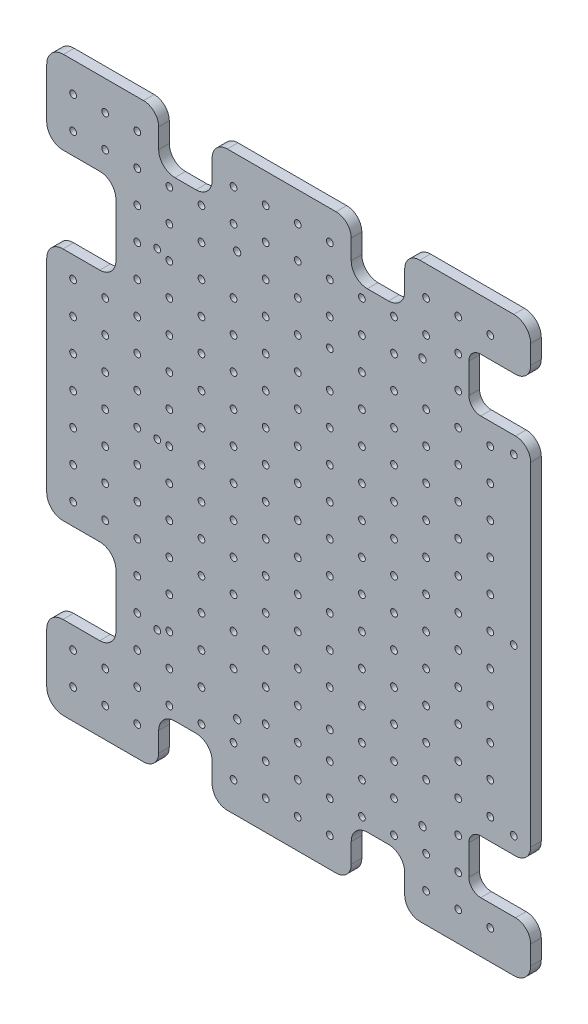
from build123d import *

# Parameters (mm, degrees)
SKETCH1_W                            = 287.27
SKETCH1_H                            = 340
BASE_PLATE_EXTRUDE_DEPTH             = 6.3
SKETCH3_R                            = 2
SKETCH3_R_2                          = 2.15
PLATE_TO_PLATE_MNT_THRU_HOLE_DEPTH   = 223.644791596
SKETCH4_R                            = 2
CENTER_PERFORATION_THRU_HOLE_DEPTH   = 223.644791596
SKETCH6_R                            = 2
EXTENDED_PERFORATION_THRU_HOLE_DEPTH = 223.644791596
CABLE_ROUTING_CUTOUT_DEPTH           = 223.644791596
FILLET1_R                            = 10


with BuildPart() as part:
    # Sketch1 → Base_Plate-Extrude (new body)
    with BuildSketch(Plane.XY):
        Rectangle(SKETCH1_W, SKETCH1_H)
    extrude(amount=BASE_PLATE_EXTRUDE_DEPTH)

    # Sketch3 → Plate_to_Plate_Mnt-Thru-Hole (cut, through all)
    with BuildSketch(Plane.XY.offset(6.3)):
        with Locations((133.635, 98)):
            Circle(SKETCH3_R)
        with Locations((24.415, 98)):
            Circle(SKETCH3_R)
        with Locations((-78.025, 98)):
            Circle(SKETCH3_R)
        with Locations((-78.025, -98)):
            Circle(SKETCH3_R)
        with Locations((24.415, -98)):
            Circle(SKETCH3_R)
        with Locations((133.635, -98)):
            Circle(SKETCH3_R)
        with Locations((133.635, 0)):
            Circle(SKETCH3_R)
        with Locations((-78.025, 0)):
            Circle(SKETCH3_R)
        with Locations((79.415, -120.25)):
            Circle(SKETCH3_R_2)
        with Locations((-30.585, -120.25)):
            Circle(SKETCH3_R_2)
        with Locations((-30.585, 120.25)):
            Circle(SKETCH3_R_2)
        with Locations((79.415, 120.25)):
            Circle(SKETCH3_R_2)
    extrude(amount=-PLATE_TO_PLATE_MNT_THRU_HOLE_DEPTH, mode=Mode.SUBTRACT)

    # Sketch4 → Center_Perforation-Thru-Hole (cut, through all)
    with BuildSketch(Plane.XY.offset(6.3)):
        with Locations((-70.835, 0)):
            Circle(SKETCH4_R)
        with Locations((-51.785, 0)):
            Circle(SKETCH4_R)
        with Locations((-32.735, 0)):
            Circle(SKETCH4_R)
        with Locations((-13.685, 0)):
            Circle(SKETCH4_R)
        with Locations((5.365, 0)):
            Circle(SKETCH4_R)
        with Locations((24.415, 0)):
            Circle(SKETCH4_R)
        with Locations((43.465, 0)):
            Circle(SKETCH4_R)
        with Locations((62.515, 0)):
            Circle(SKETCH4_R)
        with Locations((81.565, 0)):
            Circle(SKETCH4_R)
        with Locations((100.615, 0)):
            Circle(SKETCH4_R)
        with Locations((119.665, 0)):
            Circle(SKETCH4_R)
        with Locations((-70.835, 19.05)):
            Circle(SKETCH4_R)
        with Locations((-51.785, 19.05)):
            Circle(SKETCH4_R)
        with Locations((-32.735, 19.05)):
            Circle(SKETCH4_R)
        with Locations((-13.685, 19.05)):
            Circle(SKETCH4_R)
        with Locations((5.365, 19.05)):
            Circle(SKETCH4_R)
        with Locations((24.415, 19.05)):
            Circle(SKETCH4_R)
        with Locations((43.465, 19.05)):
            Circle(SKETCH4_R)
        with Locations((62.515, 19.05)):
            Circle(SKETCH4_R)
        with Locations((81.565, 19.05)):
            Circle(SKETCH4_R)
        with Locations((100.615, 19.05)):
            Circle(SKETCH4_R)
        with Locations((119.665, 19.05)):
            Circle(SKETCH4_R)
        with Locations((-70.835, 38.1)):
            Circle(SKETCH4_R)
        with Locations((-51.785, 38.1)):
            Circle(SKETCH4_R)
        with Locations((-32.735, 38.1)):
            Circle(SKETCH4_R)
        with Locations((-13.685, 38.1)):
            Circle(SKETCH4_R)
        with Locations((5.365, 38.1)):
            Circle(SKETCH4_R)
        with Locations((24.415, 38.1)):
            Circle(SKETCH4_R)
        with Locations((43.465, 38.1)):
            Circle(SKETCH4_R)
        with Locations((62.515, 38.1)):
            Circle(SKETCH4_R)
        with Locations((81.565, 38.1)):
            Circle(SKETCH4_R)
        with Locations((100.615, 38.1)):
            Circle(SKETCH4_R)
        with Locations((119.665, 38.1)):
            Circle(SKETCH4_R)
        with Locations((-70.835, 57.15)):
            Circle(SKETCH4_R)
        with Locations((-51.785, 57.15)):
            Circle(SKETCH4_R)
        with Locations((-32.735, 57.15)):
            Circle(SKETCH4_R)
        with Locations((-13.685, 57.15)):
            Circle(SKETCH4_R)
        with Locations((5.365, 57.15)):
            Circle(SKETCH4_R)
        with Locations((24.415, 57.15)):
            Circle(SKETCH4_R)
        with Locations((43.465, 57.15)):
            Circle(SKETCH4_R)
        with Locations((62.515, 57.15)):
            Circle(SKETCH4_R)
        with Locations((81.565, 57.15)):
            Circle(SKETCH4_R)
        with Locations((100.615, 57.15)):
            Circle(SKETCH4_R)
        with Locations((119.665, 57.15)):
            Circle(SKETCH4_R)
        with Locations((-70.835, -19.05)):
            Circle(SKETCH4_R)
        with Locations((-51.785, -19.05)):
            Circle(SKETCH4_R)
        with Locations((-32.735, -19.05)):
            Circle(SKETCH4_R)
        with Locations((-13.685, -19.05)):
            Circle(SKETCH4_R)
        with Locations((5.365, -19.05)):
            Circle(SKETCH4_R)
        with Locations((24.415, -19.05)):
            Circle(SKETCH4_R)
        with Locations((43.465, -19.05)):
            Circle(SKETCH4_R)
        with Locations((62.515, -19.05)):
            Circle(SKETCH4_R)
        with Locations((81.565, -19.05)):
            Circle(SKETCH4_R)
        with Locations((100.615, -19.05)):
            Circle(SKETCH4_R)
        with Locations((119.665, -19.05)):
            Circle(SKETCH4_R)
        with Locations((-70.835, -38.1)):
            Circle(SKETCH4_R)
        with Locations((-51.785, -38.1)):
            Circle(SKETCH4_R)
        with Locations((-32.735, -38.1)):
            Circle(SKETCH4_R)
        with Locations((-13.685, -38.1)):
            Circle(SKETCH4_R)
        with Locations((5.365, -38.1)):
            Circle(SKETCH4_R)
        with Locations((24.415, -38.1)):
            Circle(SKETCH4_R)
        with Locations((43.465, -38.1)):
            Circle(SKETCH4_R)
        with Locations((62.515, -38.1)):
            Circle(SKETCH4_R)
        with Locations((81.565, -38.1)):
            Circle(SKETCH4_R)
        with Locations((100.615, -38.1)):
            Circle(SKETCH4_R)
        with Locations((119.665, -38.1)):
            Circle(SKETCH4_R)
        with Locations((-70.835, -57.15)):
            Circle(SKETCH4_R)
        with Locations((-51.785, -57.15)):
            Circle(SKETCH4_R)
        with Locations((-32.735, -57.15)):
            Circle(SKETCH4_R)
        with Locations((-13.685, -57.15)):
            Circle(SKETCH4_R)
        with Locations((5.365, -57.15)):
            Circle(SKETCH4_R)
        with Locations((24.415, -57.15)):
            Circle(SKETCH4_R)
        with Locations((43.465, -57.15)):
            Circle(SKETCH4_R)
        with Locations((62.515, -57.15)):
            Circle(SKETCH4_R)
        with Locations((81.565, -57.15)):
            Circle(SKETCH4_R)
        with Locations((100.615, -57.15)):
            Circle(SKETCH4_R)
        with Locations((119.665, -57.15)):
            Circle(SKETCH4_R)
    extrude(amount=-CENTER_PERFORATION_THRU_HOLE_DEPTH, mode=Mode.SUBTRACT)

    # Sketch6 → Extended_Perforation-Thru-Hole (cut, through all)
    with BuildSketch(Plane.XY.offset(6.3)):
        with Locations((-89.885, 0)):
            Circle(SKETCH6_R)
        with Locations((-51.785, -95.25)):
            Circle(SKETCH6_R)
        with Locations((-70.835, -95.25)):
            Circle(SKETCH6_R)
        with Locations((-108.935, 0)):
            Circle(SKETCH6_R)
        with Locations((-127.985, 0)):
            Circle(SKETCH6_R)
        with Locations((-89.885, 19.05)):
            Circle(SKETCH6_R)
        with Locations((-108.935, 19.05)):
            Circle(SKETCH6_R)
        with Locations((-127.985, 19.05)):
            Circle(SKETCH6_R)
        with Locations((-89.885, 38.1)):
            Circle(SKETCH6_R)
        with Locations((-108.935, 38.1)):
            Circle(SKETCH6_R)
        with Locations((-127.985, 38.1)):
            Circle(SKETCH6_R)
        with Locations((-89.885, 57.15)):
            Circle(SKETCH6_R)
        with Locations((-108.935, 57.15)):
            Circle(SKETCH6_R)
        with Locations((-127.985, 57.15)):
            Circle(SKETCH6_R)
        with Locations((-89.885, 76.2)):
            Circle(SKETCH6_R)
        with Locations((-108.935, 76.2)):
            Circle(SKETCH6_R)
        with Locations((-127.985, 76.2)):
            Circle(SKETCH6_R)
        with Locations((-89.885, 95.25)):
            Circle(SKETCH6_R)
        with Locations((-108.935, 95.25)):
            Circle(SKETCH6_R)
        with Locations((-127.985, 95.25)):
            Circle(SKETCH6_R)
        with Locations((-89.885, 114.3)):
            Circle(SKETCH6_R)
        with Locations((-108.935, 114.3)):
            Circle(SKETCH6_R)
        with Locations((-127.985, 114.3)):
            Circle(SKETCH6_R)
        with Locations((-89.885, 133.35)):
            Circle(SKETCH6_R)
        with Locations((-108.935, 133.35)):
            Circle(SKETCH6_R)
        with Locations((-127.985, 133.35)):
            Circle(SKETCH6_R)
        with Locations((-89.885, 152.4)):
            Circle(SKETCH6_R)
        with Locations((-108.935, 152.4)):
            Circle(SKETCH6_R)
        with Locations((-127.985, 152.4)):
            Circle(SKETCH6_R)
        with Locations((-89.885, -19.05)):
            Circle(SKETCH6_R)
        with Locations((-108.935, -19.05)):
            Circle(SKETCH6_R)
        with Locations((-127.985, -19.05)):
            Circle(SKETCH6_R)
        with Locations((-89.885, -38.1)):
            Circle(SKETCH6_R)
        with Locations((-108.935, -38.1)):
            Circle(SKETCH6_R)
        with Locations((-127.985, -38.1)):
            Circle(SKETCH6_R)
        with Locations((-89.885, -57.15)):
            Circle(SKETCH6_R)
        with Locations((-108.935, -57.15)):
            Circle(SKETCH6_R)
        with Locations((-127.985, -57.15)):
            Circle(SKETCH6_R)
        with Locations((-89.885, -76.2)):
            Circle(SKETCH6_R)
        with Locations((-108.935, -76.2)):
            Circle(SKETCH6_R)
        with Locations((-127.985, -76.2)):
            Circle(SKETCH6_R)
        with Locations((-89.885, -95.25)):
            Circle(SKETCH6_R)
        with Locations((-108.935, -95.25)):
            Circle(SKETCH6_R)
        with Locations((-127.985, -95.25)):
            Circle(SKETCH6_R)
        with Locations((-89.885, -114.3)):
            Circle(SKETCH6_R)
        with Locations((-108.935, -114.3)):
            Circle(SKETCH6_R)
        with Locations((-127.985, -114.3)):
            Circle(SKETCH6_R)
        with Locations((-89.885, -133.35)):
            Circle(SKETCH6_R)
        with Locations((-108.935, -133.35)):
            Circle(SKETCH6_R)
        with Locations((-127.985, -133.35)):
            Circle(SKETCH6_R)
        with Locations((-89.885, -152.4)):
            Circle(SKETCH6_R)
        with Locations((-108.935, -152.4)):
            Circle(SKETCH6_R)
        with Locations((-127.985, -152.4)):
            Circle(SKETCH6_R)
        with Locations((-51.785, -114.3)):
            Circle(SKETCH6_R)
        with Locations((-70.835, -114.3)):
            Circle(SKETCH6_R)
        with Locations((119.665, -76.2)):
            Circle(SKETCH6_R)
        with Locations((100.615, -76.2)):
            Circle(SKETCH6_R)
        with Locations((119.665, -95.25)):
            Circle(SKETCH6_R)
        with Locations((100.615, -95.25)):
            Circle(SKETCH6_R)
        with Locations((119.665, -114.3)):
            Circle(SKETCH6_R)
        with Locations((100.615, -114.3)):
            Circle(SKETCH6_R)
        with Locations((119.665, -133.35)):
            Circle(SKETCH6_R)
        with Locations((100.615, -133.35)):
            Circle(SKETCH6_R)
        with Locations((119.665, -152.4)):
            Circle(SKETCH6_R)
        with Locations((100.615, -152.4)):
            Circle(SKETCH6_R)
        with Locations((-51.785, -133.35)):
            Circle(SKETCH6_R)
        with Locations((119.665, 76.2)):
            Circle(SKETCH6_R)
        with Locations((100.615, 76.2)):
            Circle(SKETCH6_R)
        with Locations((119.665, 95.25)):
            Circle(SKETCH6_R)
        with Locations((100.615, 95.25)):
            Circle(SKETCH6_R)
        with Locations((119.665, 114.3)):
            Circle(SKETCH6_R)
        with Locations((100.615, 114.3)):
            Circle(SKETCH6_R)
        with Locations((119.665, 133.35)):
            Circle(SKETCH6_R)
        with Locations((100.615, 133.35)):
            Circle(SKETCH6_R)
        with Locations((119.665, 152.4)):
            Circle(SKETCH6_R)
        with Locations((100.615, 152.4)):
            Circle(SKETCH6_R)
        with Locations((-70.835, 76.2)):
            Circle(SKETCH6_R)
        with Locations((-51.785, 76.2)):
            Circle(SKETCH6_R)
        with Locations((-70.835, -76.2)):
            Circle(SKETCH6_R)
        with Locations((-51.785, -76.2)):
            Circle(SKETCH6_R)
        with Locations((-51.785, 95.25)):
            Circle(SKETCH6_R)
        with Locations((-70.835, 95.25)):
            Circle(SKETCH6_R)
        with Locations((-51.785, 114.3)):
            Circle(SKETCH6_R)
        with Locations((-70.835, 114.3)):
            Circle(SKETCH6_R)
        with Locations((-51.785, 133.35)):
            Circle(SKETCH6_R)
        with Locations((-70.835, 133.35)):
            Circle(SKETCH6_R)
        with Locations((-51.785, 152.4)):
            Circle(SKETCH6_R)
        with Locations((-70.835, 152.4)):
            Circle(SKETCH6_R)
        with Locations((-70.835, -133.35)):
            Circle(SKETCH6_R)
        with Locations((-51.785, -152.4)):
            Circle(SKETCH6_R)
        with Locations((-70.835, -152.4)):
            Circle(SKETCH6_R)
        with Locations((62.515, -152.4)):
            Circle(SKETCH6_R)
        with Locations((81.565, -76.2)):
            Circle(SKETCH6_R)
        with Locations((81.565, -152.4)):
            Circle(SKETCH6_R)
        with Locations((81.565, 76.2)):
            Circle(SKETCH6_R)
        with Locations((81.565, 152.4)):
            Circle(SKETCH6_R)
        with Locations((62.515, -76.2)):
            Circle(SKETCH6_R)
        with Locations((62.515, 76.2)):
            Circle(SKETCH6_R)
        with Locations((62.515, 152.4)):
            Circle(SKETCH6_R)
        with Locations((43.465, -152.4)):
            Circle(SKETCH6_R)
        with Locations((43.465, -76.2)):
            Circle(SKETCH6_R)
        with Locations((43.465, 76.2)):
            Circle(SKETCH6_R)
        with Locations((43.465, 152.4)):
            Circle(SKETCH6_R)
        with Locations((24.415, -152.4)):
            Circle(SKETCH6_R)
        with Locations((24.415, -76.2)):
            Circle(SKETCH6_R)
        with Locations((24.415, 76.2)):
            Circle(SKETCH6_R)
        with Locations((24.415, 152.4)):
            Circle(SKETCH6_R)
        with Locations((5.365, -152.4)):
            Circle(SKETCH6_R)
        with Locations((5.365, -76.2)):
            Circle(SKETCH6_R)
        with Locations((5.365, 76.2)):
            Circle(SKETCH6_R)
        with Locations((5.365, 152.4)):
            Circle(SKETCH6_R)
        with Locations((-13.685, -152.4)):
            Circle(SKETCH6_R)
        with Locations((-13.685, -76.2)):
            Circle(SKETCH6_R)
        with Locations((-13.685, 76.2)):
            Circle(SKETCH6_R)
        with Locations((-13.685, 152.4)):
            Circle(SKETCH6_R)
        with Locations((-32.735, -152.4)):
            Circle(SKETCH6_R)
        with Locations((-32.735, -76.2)):
            Circle(SKETCH6_R)
        with Locations((-32.735, 76.2)):
            Circle(SKETCH6_R)
        with Locations((-32.735, 152.4)):
            Circle(SKETCH6_R)
        with Locations((81.565, -133.35)):
            Circle(SKETCH6_R)
        with Locations((-32.735, -133.35)):
            Circle(SKETCH6_R)
        with Locations((5.365, -95.25)):
            Circle(SKETCH6_R)
        with Locations((-13.685, -95.25)):
            Circle(SKETCH6_R)
        with Locations((-32.735, -95.25)):
            Circle(SKETCH6_R)
        with Locations((81.565, -95.25)):
            Circle(SKETCH6_R)
        with Locations((62.515, -95.25)):
            Circle(SKETCH6_R)
        with Locations((43.465, -95.25)):
            Circle(SKETCH6_R)
        with Locations((-32.735, 95.25)):
            Circle(SKETCH6_R)
        with Locations((-13.685, 95.25)):
            Circle(SKETCH6_R)
        with Locations((5.365, 95.25)):
            Circle(SKETCH6_R)
        with Locations((43.465, 95.25)):
            Circle(SKETCH6_R)
        with Locations((62.515, 95.25)):
            Circle(SKETCH6_R)
        with Locations((81.565, 95.25)):
            Circle(SKETCH6_R)
        with Locations((62.515, 133.35)):
            Circle(SKETCH6_R)
        with Locations((43.465, 133.35)):
            Circle(SKETCH6_R)
        with Locations((24.415, 133.35)):
            Circle(SKETCH6_R)
        with Locations((5.365, 133.35)):
            Circle(SKETCH6_R)
        with Locations((-13.685, 133.35)):
            Circle(SKETCH6_R)
        with Locations((62.515, 114.3)):
            Circle(SKETCH6_R)
        with Locations((43.465, 114.3)):
            Circle(SKETCH6_R)
        with Locations((24.415, 114.3)):
            Circle(SKETCH6_R)
        with Locations((5.365, 114.3)):
            Circle(SKETCH6_R)
        with Locations((-13.685, 114.3)):
            Circle(SKETCH6_R)
        with Locations((62.515, -133.35)):
            Circle(SKETCH6_R)
        with Locations((43.465, -133.35)):
            Circle(SKETCH6_R)
        with Locations((24.415, -133.35)):
            Circle(SKETCH6_R)
        with Locations((5.365, -133.35)):
            Circle(SKETCH6_R)
        with Locations((-13.685, -133.35)):
            Circle(SKETCH6_R)
        with Locations((62.515, -114.3)):
            Circle(SKETCH6_R)
        with Locations((43.465, -114.3)):
            Circle(SKETCH6_R)
        with Locations((24.415, -114.3)):
            Circle(SKETCH6_R)
        with Locations((5.365, -114.3)):
            Circle(SKETCH6_R)
        with Locations((-13.685, -114.3)):
            Circle(SKETCH6_R)
        with Locations((81.565, 133.35)):
            Circle(SKETCH6_R)
        with Locations((-32.735, 133.35)):
            Circle(SKETCH6_R)
    extrude(amount=-EXTENDED_PERFORATION_THRU_HOLE_DEPTH, mode=Mode.SUBTRACT)

    # Sketch10 → Cable_Routing-Cutout (cut, through all)
    with BuildSketch(Plane(origin=(0, 0, 0), x_dir=(-1, 0, 0), z_dir=(0, 0, -1))):
        with BuildLine():
            Line((134.035, -69.85), (112.185, -69.85))
            ThreePointArc((112.185, -69.85), (105.396774901, -72.661774901), (102.585, -79.45))
            Line((102.585, -79.45), (102.585, -111.05))
            ThreePointArc((102.585, -111.05), (105.396774901, -117.838225099), (112.185, -120.65))
            Line((112.185, -120.65), (134.035, -120.65))
            ThreePointArc((134.035, -120.65), (140.823225099, -123.461774901), (143.635, -130.25))
            Line((143.635, -130.25), (143.635, -60.25))
            ThreePointArc((143.635, -60.25), (140.823225099, -67.038225099), (134.035, -69.85))
        make_face()
        with BuildLine():
            Line((143.635, 130.25), (143.635, 60.25))
            ThreePointArc((143.635, 60.25), (140.823225099, 67.038225099), (134.035, 69.85))
            Line((134.035, 69.85), (112.185, 69.85))
            ThreePointArc((112.185, 69.85), (105.396774901, 72.661774901), (102.585, 79.45))
            Line((102.585, 79.45), (102.585, 111.05))
            ThreePointArc((102.585, 111.05), (105.396774901, 117.838225099), (112.185, 120.65))
            Line((112.185, 120.65), (134.035, 120.65))
            ThreePointArc((134.035, 120.65), (140.823225099, 123.461774901), (143.635, 130.25))
        make_face()
        with BuildLine():
            Line((-113.965, 139.7), (-134.635, 139.7))
            ThreePointArc((-134.635, 139.7), (-140.998961031, 142.336038969), (-143.635, 148.7))
            Line((-143.635, 148.7), (-143.635, 98.95))
            ThreePointArc((-143.635, 98.95), (-140.998961031, 105.313961031), (-134.635, 107.95))
            Line((-134.635, 107.95), (-113.965, 107.95))
            ThreePointArc((-113.965, 107.95), (-109.015252532, 110.000252532), (-106.965, 114.95))
            Line((-106.965, 114.95), (-106.965, 132.7))
            ThreePointArc((-106.965, 132.7), (-109.015252532, 137.649747468), (-113.965, 139.7))
        make_face()
        with BuildLine():
            Line((-113.965, -107.95), (-134.635, -107.95))
            ThreePointArc((-134.635, -107.95), (-140.998961031, -105.313961031), (-143.635, -98.95))
            Line((-143.635, -98.95), (-143.635, -148.7))
            ThreePointArc((-143.635, -148.7), (-140.998961031, -142.336038969), (-134.635, -139.7))
            Line((-134.635, -139.7), (-113.965, -139.7))
            ThreePointArc((-113.965, -139.7), (-109.015252532, -137.649747468), (-106.965, -132.7))
            Line((-106.965, -132.7), (-106.965, -114.95))
            ThreePointArc((-106.965, -114.95), (-109.015252532, -110.000252532), (-113.965, -107.95))
        make_face()
        with BuildLine():
            Line((-59.265, -139.7), (-46.715, -139.7))
            ThreePointArc((-46.715, -139.7), (-39.926774901, -142.511774901), (-37.115, -149.3))
            Line((-37.115, -149.3), (-37.115, -161))
            ThreePointArc((-37.115, -161), (-34.478961031, -167.363961031), (-28.115, -170))
            Line((-28.115, -170), (-77.865, -170))
            ThreePointArc((-77.865, -170), (-71.501038969, -167.363961031), (-68.865, -161))
            Line((-68.865, -161), (-68.865, -149.3))
            ThreePointArc((-68.865, -149.3), (-66.053225099, -142.511774901), (-59.265, -139.7))
        make_face()
        with BuildLine():
            Line((55.035, -139.7), (67.585, -139.7))
            ThreePointArc((67.585, -139.7), (74.373225099, -142.511774901), (77.185, -149.3))
            Line((77.185, -149.3), (77.185, -161))
            ThreePointArc((77.185, -161), (79.821038969, -167.363961031), (86.185, -170))
            Line((86.185, -170), (36.435, -170))
            ThreePointArc((36.435, -170), (42.798961031, -167.363961031), (45.435, -161))
            Line((45.435, -161), (45.435, -149.3))
            ThreePointArc((45.435, -149.3), (48.246774901, -142.511774901), (55.035, -139.7))
        make_face()
        with BuildLine():
            Line((36.435, 170), (86.185, 170))
            ThreePointArc((86.185, 170), (79.821038969, 167.363961031), (77.185, 161))
            Line((77.185, 161), (77.185, 149.3))
            ThreePointArc((77.185, 149.3), (74.373225099, 142.511774901), (67.585, 139.7))
            Line((67.585, 139.7), (55.035, 139.7))
            ThreePointArc((55.035, 139.7), (48.246774901, 142.511774901), (45.435, 149.3))
            Line((45.435, 149.3), (45.435, 161))
            ThreePointArc((45.435, 161), (42.798961031, 167.363961031), (36.435, 170))
        make_face()
        with BuildLine():
            Line((-77.865, 170), (-28.115, 170))
            ThreePointArc((-28.115, 170), (-34.478961031, 167.363961031), (-37.115, 161))
            Line((-37.115, 161), (-37.115, 149.3))
            ThreePointArc((-37.115, 149.3), (-39.926774901, 142.511774901), (-46.715, 139.7))
            Line((-46.715, 139.7), (-59.265, 139.7))
            ThreePointArc((-59.265, 139.7), (-66.053225099, 142.511774901), (-68.865, 149.3))
            Line((-68.865, 149.3), (-68.865, 161))
            ThreePointArc((-68.865, 161), (-71.501038969, 167.363961031), (-77.865, 170))
        make_face()
    extrude(amount=-CABLE_ROUTING_CUTOUT_DEPTH, mode=Mode.SUBTRACT)

    # Fillet1
    fillet1_edges = [part.edges().sort_by_distance(p)[0] for p in [
        (-143.635, -170, 3.15),
        (-143.635, 170, 3.15),
        (143.635, 170, 3.15),
        (143.635, -170, 3.15),
    ]]
    fillet(fillet1_edges, radius=FILLET1_R)


solid = part.part
